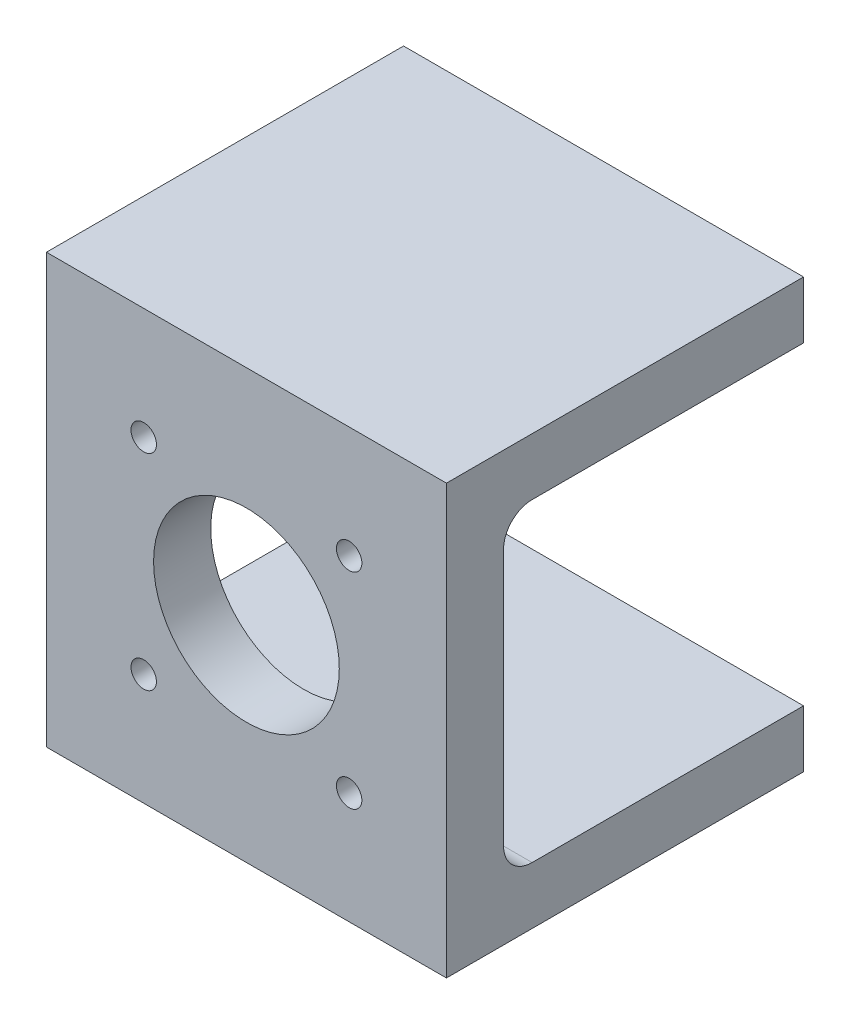
from build123d import *

# Parameters (mm, degrees)
SKETCH1_W                                    = 35.56
SKETCH1_H                                    = 38.1
SKETCH1_R                                    = 8.255
SKETCH1_R_2                                  = 1.1303
BOSS_EXTRUDE_WITH_4_40_TAP_DRILL_HOLES_DEPTH = 15.875
CUT_EXTRUDE1_REACH                           = 45.352
SKETCH3_W                                    = 26.67
SKETCH3_H                                    = 27.94
FILLET1_R                                    = 2.54


with BuildPart() as part:
    # Sketch1 → Boss-Extrude with 4-40 Tap Drill Holes (new, symmetric)
    with BuildSketch(Plane.XY):
        Rectangle(SKETCH1_W, SKETCH1_H)
        Circle(SKETCH1_R, mode=Mode.SUBTRACT)
        with Locations((-9.1313, 9.1313)):
            Circle(SKETCH1_R_2, mode=Mode.SUBTRACT)
        with Locations((9.1313, 9.1313)):
            Circle(SKETCH1_R_2, mode=Mode.SUBTRACT)
        with Locations((-9.1313, -9.1313)):
            Circle(SKETCH1_R_2, mode=Mode.SUBTRACT)
        with Locations((9.1313, -9.1313)):
            Circle(SKETCH1_R_2, mode=Mode.SUBTRACT)
    extrude(amount=BOSS_EXTRUDE_WITH_4_40_TAP_DRILL_HOLES_DEPTH, both=True)

    # Sketch3 → Cut-Extrude1 (cut, up to next)
    with BuildSketch(Plane(origin=(17.78, 0, 0), x_dir=(0, 0, -1), z_dir=(1, 0, 0)), mode=Mode.PRIVATE) as cut_extrude1_sk1:
        with Locations((2.54, 0)):
            Rectangle(SKETCH3_W, SKETCH3_H)
    cut_extrude1_tool1 = extrude(cut_extrude1_sk1.sketch, amount=-CUT_EXTRUDE1_REACH, mode=Mode.PRIVATE) & part.part
    add(cut_extrude1_tool1.solids().sort_by_distance((17.78, 0, -2.54))[0], mode=Mode.SUBTRACT)

    # Fillet1
    fillet1_edges = [part.edges().sort_by_distance(p)[0] for p in [
        (0, -13.97, 10.795),
        (0, 13.97, 10.795),
    ]]
    fillet(fillet1_edges, radius=FILLET1_R)


solid = part.part
